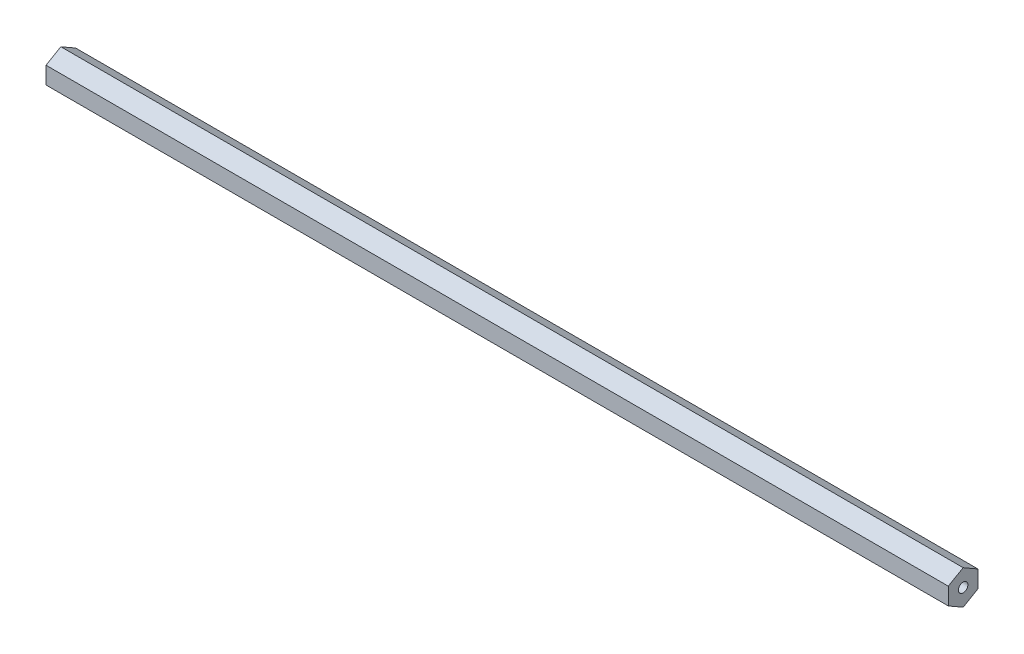
from build123d import *

# Parameters (mm, degrees)
BOSS_EXTRUDE1_DEPTH                  = 192.88125
F_10_32_TAPPED_HOLE1_D               = 4.0386
F_10_32_TAPPED_HOLE1_DEPTH           = 16.34744
F_10_32_TAPPED_HOLE1_TIP             = 1.213317848
F_10_32_TAPPED_HOLE1_ON_FACE_2_D     = 4.0386
F_10_32_TAPPED_HOLE1_ON_FACE_2_DEPTH = 16.34744
F_10_32_TAPPED_HOLE1_ON_FACE_2_TIP   = 1.213317848


with BuildPart() as part:
    # Sketch1 → Boss-Extrude1 (new, symmetric)
    with BuildSketch(Plane(origin=(0, 0, 0), x_dir=(0, 0, -1), z_dir=(1, 0, 0))):
        Polygon((6.35, 3.666174209), (0, 7.332348419), (-6.35, 3.666174209), (-6.35, -3.666174209), (0, -7.332348419), (6.35, -3.666174209), align=None)
    extrude(amount=BOSS_EXTRUDE1_DEPTH, both=True)

    # #10-32 Tapped Hole1
    with Locations(Plane(origin=(192.88125, 0, 0), x_dir=(0, 0, 1), z_dir=(1, 0, 0))):
        with Locations((0, 0)):
            Hole(F_10_32_TAPPED_HOLE1_D / 2, depth=F_10_32_TAPPED_HOLE1_DEPTH)
            with Locations((0, 0, -(F_10_32_TAPPED_HOLE1_DEPTH + F_10_32_TAPPED_HOLE1_TIP / 2))):  # 118° drill point
                Cone(0, F_10_32_TAPPED_HOLE1_D / 2, F_10_32_TAPPED_HOLE1_TIP, mode=Mode.SUBTRACT)

    # #10-32 Tapped Hole1 on face 2
    with Locations(Plane(origin=(-192.88125, 0, 0), x_dir=(0, 0, -1), z_dir=(-1, 0, 0))):
        with Locations((0, 0)):
            Hole(F_10_32_TAPPED_HOLE1_ON_FACE_2_D / 2, depth=F_10_32_TAPPED_HOLE1_ON_FACE_2_DEPTH)
            with Locations((0, 0, -(F_10_32_TAPPED_HOLE1_ON_FACE_2_DEPTH + F_10_32_TAPPED_HOLE1_ON_FACE_2_TIP / 2))):  # 118° drill point
                Cone(0, F_10_32_TAPPED_HOLE1_ON_FACE_2_D / 2, F_10_32_TAPPED_HOLE1_ON_FACE_2_TIP, mode=Mode.SUBTRACT)


solid = part.part
